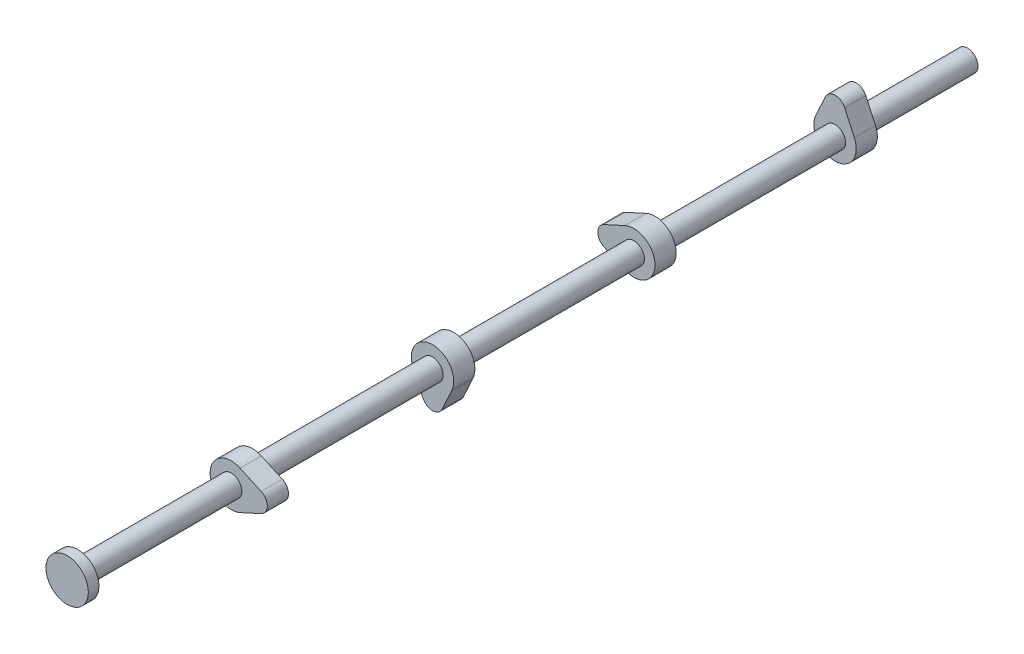
from build123d import *

# Parameters (mm, degrees)
SKETCH1_R                   = 127
BOSS_EXTRUDE1_DEPTH         = 2413
BOSS_EXTRUDE2_DEPTH         = 127
BODY_MOVE_COPY1_START       = 7239
BODY_MOVE_COPY1_OUTLINE_R   = 127
BODY_MOVE_COPY1_DEPTH       = 2413
BODY_MOVE_COPY1_START_2     = 8318.5
BODY_MOVE_COPY1_2_OUTLINE_R = 127
BODY_MOVE_COPY1_2_DEPTH     = 254
BODY_MOVE_COPY1_START_3     = 2413
BODY_MOVE_COPY1_3_OUTLINE_R = 127
BODY_MOVE_COPY1_3_DEPTH     = 2413
BODY_MOVE_COPY1_START_4     = 3492.5
BODY_MOVE_COPY1_4_OUTLINE_R = 127
BODY_MOVE_COPY1_4_DEPTH     = 254
BODY_MOVE_COPY1_START_5     = 4826
BODY_MOVE_COPY1_5_OUTLINE_R = 127
BODY_MOVE_COPY1_5_DEPTH     = 2413
BODY_MOVE_COPY1_START_6     = 5905.5
BODY_MOVE_COPY1_6_OUTLINE_R = 127
BODY_MOVE_COPY1_6_DEPTH     = 254
BODY_MOVE_COPY2_ANGLE       = 90
BODY_MOVE_COPY3_ANGLE       = 180
BODY_MOVE_COPY4_ANGLE       = 90
BOSS_EXTRUDE3_START         = 254
SKETCH4_R                   = 127
BOSS_EXTRUDE3_DEPTH         = 254
SKETCH5_R                   = 127
BOSS_EXTRUDE4_DEPTH         = 762
SKETCH6_R                   = 254
BOSS_EXTRUDE5_DEPTH         = 127


# Read off the part's stored shape, not the designer's step: Body-Move/Copy1
with BuildPart() as part:
    # Sketch1 → Boss-Extrude1 (new body)
    with BuildSketch(Plane.XY):
        Circle(SKETCH1_R)
    extrude(amount=BOSS_EXTRUDE1_DEPTH)

    # Sketch2 → Boss-Extrude2 (add, symmetric)
    with BuildSketch(Plane.XY.offset(1206.5)):
        with BuildLine():
            Line((105.833333333, 230.901073093), (357.716666667, 115.450536547))
            ThreePointArc((357.716666667, 115.450536547), (431.8, 0), (357.716666667, -115.450536547))
            Line((357.716666667, -115.450536547), (105.833333333, -230.901073093))
            ThreePointArc((105.833333333, -230.901073093), (-254, 0), (105.833333333, 230.901073093))
        make_face()
    extrude(amount=BOSS_EXTRUDE2_DEPTH, both=True)


with BuildPart() as body_2:
    # Body-Move/Copy1 outline → Body-Move/Copy1 (new body)
    with BuildSketch(Plane.XY.offset(BODY_MOVE_COPY1_START)):
        Circle(BODY_MOVE_COPY1_OUTLINE_R)
    extrude(amount=BODY_MOVE_COPY1_DEPTH)

    # Body-Move_Copy1 2 outline → Body-Move_Copy1 2 (add)
    with BuildSketch(Plane.XY.offset(BODY_MOVE_COPY1_START_2)):
        with BuildLine():
            ThreePointArc((105.833333333, 230.901073093), (-254, 0), (105.833333333, -230.901073093))
            Line((105.833333333, -230.901073093), (357.716666667, -115.450536547))
            ThreePointArc((357.716666667, -115.450536547), (431.8, 0), (357.716666667, 115.450536547))
            Line((357.716666667, 115.450536547), (105.833333333, 230.901073093))
        make_face()
        Circle(BODY_MOVE_COPY1_2_OUTLINE_R, mode=Mode.SUBTRACT)
    extrude(amount=BODY_MOVE_COPY1_2_DEPTH)


with BuildPart() as body_3:
    # Body-Move_Copy1 3 outline → Body-Move_Copy1 3 (new body)
    with BuildSketch(Plane.XY.offset(BODY_MOVE_COPY1_START_3)):
        Circle(BODY_MOVE_COPY1_3_OUTLINE_R)
    extrude(amount=BODY_MOVE_COPY1_3_DEPTH)

    # Body-Move_Copy1 4 outline → Body-Move_Copy1 4 (add)
    with BuildSketch(Plane.XY.offset(BODY_MOVE_COPY1_START_4)):
        with BuildLine():
            ThreePointArc((105.833333333, 230.901073093), (-254, 0), (105.833333333, -230.901073093))
            Line((105.833333333, -230.901073093), (357.716666667, -115.450536547))
            ThreePointArc((357.716666667, -115.450536547), (431.8, 0), (357.716666667, 115.450536547))
            Line((357.716666667, 115.450536547), (105.833333333, 230.901073093))
        make_face()
        Circle(BODY_MOVE_COPY1_4_OUTLINE_R, mode=Mode.SUBTRACT)
    extrude(amount=BODY_MOVE_COPY1_4_DEPTH)


with BuildPart() as body_4:
    # Body-Move_Copy1 5 outline → Body-Move_Copy1 5 (new body)
    with BuildSketch(Plane.XY.offset(BODY_MOVE_COPY1_START_5)):
        Circle(BODY_MOVE_COPY1_5_OUTLINE_R)
    extrude(amount=BODY_MOVE_COPY1_5_DEPTH)

    # Body-Move_Copy1 6 outline → Body-Move_Copy1 6 (add)
    with BuildSketch(Plane.XY.offset(BODY_MOVE_COPY1_START_6)):
        with BuildLine():
            ThreePointArc((105.833333333, 230.901073093), (-254, 0), (105.833333333, -230.901073093))
            Line((105.833333333, -230.901073093), (357.716666667, -115.450536547))
            ThreePointArc((357.716666667, -115.450536547), (431.8, 0), (357.716666667, 115.450536547))
            Line((357.716666667, 115.450536547), (105.833333333, 230.901073093))
        make_face()
        Circle(BODY_MOVE_COPY1_6_OUTLINE_R, mode=Mode.SUBTRACT)
    extrude(amount=BODY_MOVE_COPY1_6_DEPTH)


with BuildPart() as body_4_1:
    # Body-Move/Copy2: moved
    add(body_4.part.rotate(Axis((0, 0, 0), (0, 0, -1)), BODY_MOVE_COPY2_ANGLE))


with BuildPart() as body_3_1:
    # Body-Move/Copy3: moved
    add(body_3.part.rotate(Axis((0, 0, 0), (0, 0, 1)), BODY_MOVE_COPY3_ANGLE))


with BuildPart() as part_1:
    # Body-Move/Copy4: moved
    add(part.part.rotate(Axis((0, 0, 0), (0, 0, 1)), BODY_MOVE_COPY4_ANGLE))

    # Combine1: union body 2, body 4, body 3
    add(body_2.part)
    add(body_4_1.part)
    add(body_3_1.part)

    # Sketch4 → Boss-Extrude3 (add)
    with BuildSketch(Plane(origin=(0, 0, 0), x_dir=(-1, 0, 0), z_dir=(0, 0, -1)).offset(BOSS_EXTRUDE3_START)):
        Circle(SKETCH4_R)
    extrude(amount=-BOSS_EXTRUDE3_DEPTH)

    # Sketch5 → Boss-Extrude4 (add)
    with BuildSketch(Plane.XY.offset(9652)):
        with Locations(Location((0, 0, 0), (0, 0, 180))):
            Circle(SKETCH5_R)
    extrude(amount=BOSS_EXTRUDE4_DEPTH)

    # Sketch6 → Boss-Extrude5 (add)
    with BuildSketch(Plane.XY.offset(10414)):
        Circle(SKETCH6_R)
    extrude(amount=BOSS_EXTRUDE5_DEPTH)


solid = part_1.part
